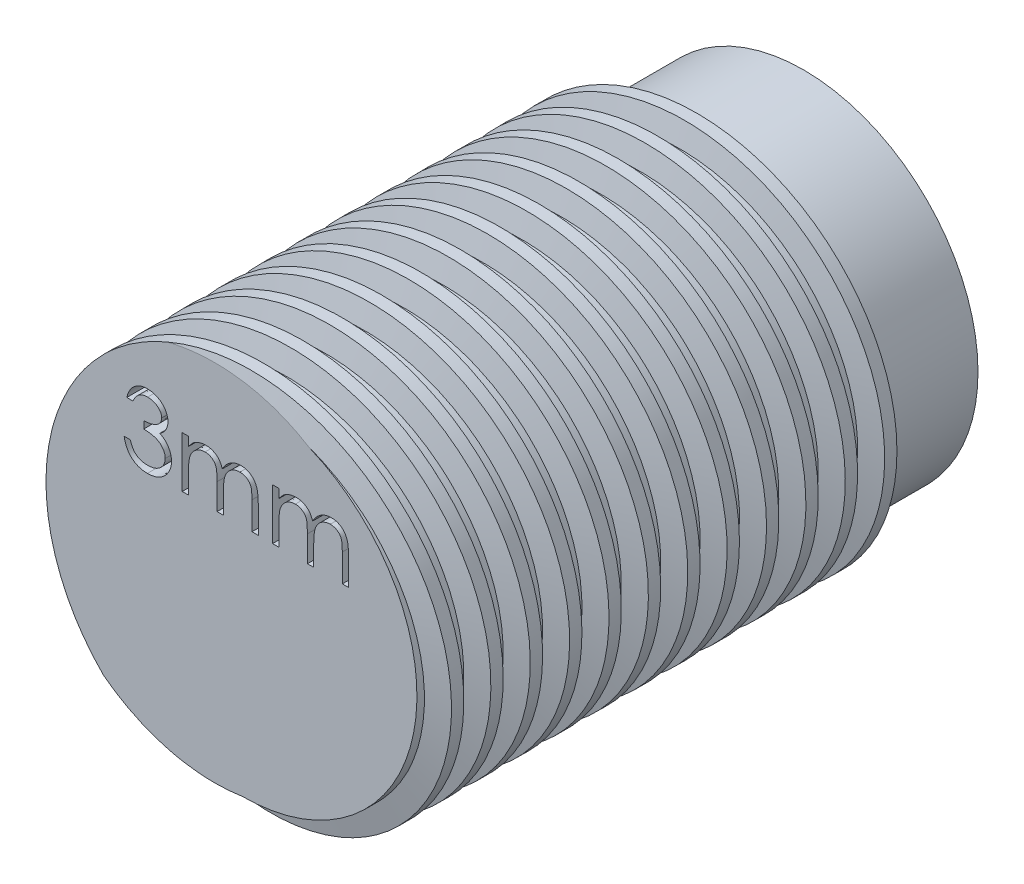
from build123d import *

# Parameters (mm, degrees)
SKETCH1_R           = 4.5
BOSS_EXTRUDE1_DEPTH = 16
SWEEP2_PITCH        = 1.016
SKETCH9_R           = 6.35
CUT_EXTRUDE2_DEPTH  = 1.524
CUT_EXTRUDE14_DEPTH = 7.5
CUT_EXTRUDE16_DEPTH = 1.5
SKETCH25_R          = 1.5
CUT_EXTRUDE17_DEPTH = 1.5


with BuildPart() as part:
    # Sketch1 → Boss-Extrude1 (new body)
    with BuildSketch(Plane.XY):
        Circle(SKETCH1_R)
    extrude(amount=BOSS_EXTRUDE1_DEPTH)

    # Sweep2: arcs per turn and ends read off the stored shape
    # Sweep2: the profile of Sketch7 profile screwed along a right-hand helix through 13.779528 turns, 8 arcs to a turn; built about Z, then put on its axis
    sweep2_z = Axis((0, 0, 0), (0, 0, 1))
    sweep2_corners = [(4.4997, 0, -0.126933333), (4.4997, 0, -0.698566667), (5.0715, 0, -0.5715), (5.0715, 0, -0.254)]
    with BuildLine(mode=Mode.PRIVATE) as sweep2_profile:
        Line(sweep2_corners[0], sweep2_corners[1])
        Line(sweep2_corners[1], sweep2_corners[2])
        Line(sweep2_corners[2], sweep2_corners[3])
        Line(sweep2_corners[3], sweep2_corners[0])
    sweep2_cap = Face(sweep2_profile.wire())
    sweep2_turn_angles = [0, 22.5, 45, 67.5, 90, 112.5, 135, 157.5, 180, 202.5, 225, 247.5, 270, 292.5, 315, 337.5, 360]
    sweep2_turn_weights = [1, 0.9238795325112867, 1, 0.9238795325112867, 1, 0.9238795325112867, 1, 0.9238795325112867, 1, 0.9238795325112867, 1, 0.9238795325112867, 1, 0.9238795325112867, 1, 0.9238795325112867, 1]
    sweep2_turn_rails = [Edge.make_bspline([Vector(p[0], p[1], 0).rotate(sweep2_z, sweep2_turn_angles[k]) / sweep2_turn_weights[k] + Vector(0, 0, p[2] + SWEEP2_PITCH * sweep2_turn_angles[k] / 360) for k in range(17)], [0, 0, 0, 1, 1, 2, 2, 3, 3, 4, 4, 5, 5, 6, 6, 7, 7, 8, 8, 8], 2, sweep2_turn_weights) for p in sweep2_corners]
    sweep2_turn_sides = [Face.make_surface_from_curves(sweep2_turn_rails[p[0]], sweep2_turn_rails[p[1]]) for p in [(0, 1), (1, 2), (2, 3), (3, 0)]]
    sweep2_last_angles = [4680, 4702.5, 4725, 4747.5, 4770, 4792.5, 4815, 4837.5, 4860, 4882.5, 4905, 4927.5, 4950, 4955.31496063, 4960.62992126]
    sweep2_last_weights = [1, 0.9238795325112867, 1, 0.9238795325112867, 1, 0.9238795325112867, 1, 0.9238795325112867, 1, 0.9238795325112867, 1, 0.9238795325112867, 1, 0.9957005451488445, 1]
    sweep2_last_rails = [Edge.make_bspline([Vector(p[0], p[1], 0).rotate(sweep2_z, sweep2_last_angles[k]) / sweep2_last_weights[k] + Vector(0, 0, p[2] + SWEEP2_PITCH * sweep2_last_angles[k] / 360) for k in range(15)], [0, 0, 0, 1, 1, 2, 2, 3, 3, 4, 4, 5, 5, 6, 6, 7, 7, 7], 2, sweep2_last_weights) for p in sweep2_corners]
    sweep2_last_sides = [Face.make_surface_from_curves(sweep2_last_rails[p[0]], sweep2_last_rails[p[1]]) for p in [(0, 1), (1, 2), (2, 3), (3, 0)]]
    sweep2 = Plane(origin=(0, 0, 16), x_dir=(-0.7071067811865512, 0.7071067811865438, 0), z_dir=(0, 0, -1)) * Solid(Shell([*[p.moved(Location((0, 0, SWEEP2_PITCH * i))) for i in range(13) for p in sweep2_turn_sides], *sweep2_last_sides, sweep2_cap, sweep2_cap.rotate(sweep2_z, 4960.62992126).moved(Location((0, 0, SWEEP2_PITCH * 4960.62992126 / 360)))]))
    add(sweep2)

    # Sketch9 → Cut-Extrude2 (cut, symmetric)
    with BuildSketch(Plane.XY.offset(16)):
        Circle(SKETCH9_R)
    extrude(amount=CUT_EXTRUDE2_DEPTH, both=True, mode=Mode.SUBTRACT)

    # Sketch21 → Cut-Extrude14 (cut)
    with BuildSketch(Plane(origin=(0, 0, 0), x_dir=(-1, 0, 0), z_dir=(0, 0, -1))):
        with BuildLine():
            Line((-1.16, 0.950999474), (-1.16, -0.950999474))
            ThreePointArc((-1.16, -0.950999474), (1.5, 0), (-1.16, 0.950999474))
        make_face()
    extrude(amount=-CUT_EXTRUDE14_DEPTH, mode=Mode.SUBTRACT)

    # Sketch24 → Cut-Extrude16 (cut)
    with BuildSketch(Plane.XY.offset(14.476)):
        with BuildLine():
            Line((-2.825209766, 2.923348698), (-2.986748228, 2.923348698))
            add(Edge.make_bspline(
                [(-2.986748228, 2.923348698), (-2.982371888, 2.941468261), (-2.9738165, 2.976890525), (-2.955972034, 3.027499973), (-2.936532417, 3.07539207), (-2.913189449, 3.119670051), (-2.887727804, 3.161223772), (-2.858556118, 3.19911075), (-2.827020261, 3.234294561), (-2.792138859, 3.265518512), (-2.755558404, 3.293792773), (-2.716763457, 3.317899945), (-2.67653454, 3.338638081), (-2.634592929, 3.355722772), (-2.590813755, 3.368593041), (-2.545592806, 3.377930827), (-2.498811577, 3.383994828), (-2.467055673, 3.384586649), (-2.45093092, 3.384887159)],
                knots=[0, 0, 0, 0, 1.162005537, 2.271625781, 3.343758855, 4.383309926, 5.390229558, 6.379919256, 7.361854164, 8.333198761, 9.295911338, 10.242430842, 11.177959212, 12.116337295, 13.062827104, 14.020064771, 14.994644689, 16, 16, 16, 16], degree=3))
            add(Edge.make_bspline(
                [(-2.45093092, 3.384887159), (-2.427436939, 3.384177841), (-2.380961447, 3.382774676), (-2.312683309, 3.369961538), (-2.246840945, 3.349685755), (-2.184155046, 3.321670695), (-2.125928423, 3.28711722), (-2.074121242, 3.245992498), (-2.029435722, 3.19909), (-1.991947185, 3.147284682), (-1.962594328, 3.091918991), (-1.940949907, 3.034936053), (-1.927773043, 2.976471039), (-1.926065328, 2.936995867), (-1.925209766, 2.91721889)],
                knots=[0, 0, 0, 0, 1.083050992, 2.142477498, 3.193116406, 4.255571735, 5.30263384, 6.308962982, 7.297363603, 8.282367274, 9.249857812, 10.179914175, 11.08814088, 12, 12, 12, 12], degree=3))
            add(Edge.make_bspline(
                [(-1.925209766, 2.91721889), (-1.925808185, 2.898186824), (-1.926979196, 2.860944025), (-1.936922245, 2.806572969), (-1.95365518, 2.755328717), (-1.976833915, 2.706995548), (-2.006838141, 2.661879916), (-2.043184099, 2.619880315), (-2.086128325, 2.580810463), (-2.118671779, 2.558429019), (-2.135426113, 2.54690639)],
                knots=[0, 0, 0, 0, 1.024540389, 2.004866551, 2.965041327, 3.920577974, 4.882998113, 5.874504559, 6.905732034, 8, 8, 8, 8], degree=3))
            add(Edge.make_bspline(
                [(-2.135426113, 2.54690639), (-2.116278353, 2.537660473), (-2.078341103, 2.519341638), (-2.026629403, 2.48341582), (-1.979686495, 2.441935412), (-1.95350744, 2.409564905), (-1.940353997, 2.393300621)],
                knots=[0, 0, 0, 0, 1.015518401, 2.012035669, 3.001164323, 4, 4, 4, 4], degree=3))
            add(Edge.make_bspline(
                [(-1.940353997, 2.393300621), (-1.931692735, 2.381442348), (-1.914512046, 2.357919991), (-1.8933052, 2.320101258), (-1.874066227, 2.281863349), (-1.859074686, 2.242181369), (-1.847465268, 2.201515248), (-1.839166737, 2.159795158), (-1.834011465, 2.116987033), (-1.833273181, 2.088026328), (-1.832902074, 2.07346889)],
                knots=[0, 0, 0, 0, 1.025084078, 2.033381695, 3.024893161, 4.013698104, 4.991890475, 5.976764909, 6.982997093, 8, 8, 8, 8], degree=3))
            add(Edge.make_bspline(
                [(-1.832902074, 2.07346889), (-1.833824967, 2.048263891), (-1.835666409, 1.997972507), (-1.852125647, 1.923671221), (-1.877641028, 1.851040963), (-1.913876024, 1.781573903), (-1.958036457, 1.716578278), (-2.010574509, 1.658424748), (-2.070893234, 1.608436894), (-2.13816471, 1.566671634), (-2.211047805, 1.533285274), (-2.289000966, 1.510112875), (-2.370900994, 1.495020647), (-2.427064747, 1.493402257), (-2.45561842, 1.492579467)],
                knots=[0, 0, 0, 0, 0.955779014, 1.907060117, 2.875433937, 3.871313158, 4.872415639, 5.851225146, 6.836215519, 7.83643374, 8.849228613, 9.86973379, 10.916971861, 12, 12, 12, 12], degree=3))
            add(Edge.make_bspline(
                [(-2.45561842, 1.492579467), (-2.474862632, 1.493025977), (-2.512728823, 1.493904559), (-2.568396908, 1.499910696), (-2.621533782, 1.510880413), (-2.672211289, 1.525642113), (-2.720474451, 1.544357866), (-2.766175991, 1.567664625), (-2.809597079, 1.595081969), (-2.850327968, 1.626933529), (-2.888363803, 1.662563932), (-2.922693775, 1.702605709), (-2.95389024, 1.746318659), (-2.981117883, 1.794210517), (-3.005616887, 1.845662363), (-3.025767093, 1.90133302), (-3.043502529, 1.960724802), (-3.05174831, 2.002113354), (-3.055978997, 2.023348698)],
                knots=[0, 0, 0, 0, 1.048658725, 2.063410685, 3.046034179, 4.001477787, 4.936774919, 5.862367409, 6.792675028, 7.730719943, 8.675894397, 9.627829632, 10.600096036, 11.597688215, 12.626045268, 13.701542398, 14.82072376, 16, 16, 16, 16], degree=3))
            Line((-3.055978997, 2.023348698), (-2.894440536, 2.023348698))
            add(Edge.make_bspline(
                [(-2.894440536, 2.023348698), (-2.890231986, 2.009489205), (-2.882045991, 1.982531288), (-2.86811178, 1.943733417), (-2.852236669, 1.908166418), (-2.835206324, 1.875569384), (-2.817320266, 1.845621291), (-2.797306876, 1.819114044), (-2.776648459, 1.794883369), (-2.76107622, 1.781231854), (-2.753454959, 1.774550621)],
                knots=[0, 0, 0, 0, 1.198163088, 2.33053128, 3.407730985, 4.417276592, 5.372219308, 6.28897303, 7.162600585, 8, 8, 8, 8], degree=3))
            add(Edge.make_bspline(
                [(-2.753454959, 1.774550621), (-2.743376719, 1.76678062), (-2.72325135, 1.751264604), (-2.69045626, 1.731463767), (-2.655965747, 1.714306668), (-2.619032486, 1.701200767), (-2.580453461, 1.690103684), (-2.539605102, 1.682841703), (-2.49684779, 1.677859215), (-2.46765294, 1.677419536), (-2.452733805, 1.677194852)],
                knots=[0, 0, 0, 0, 0.946170439, 1.889420265, 2.845303464, 3.807233317, 4.801018734, 5.828864929, 6.890507805, 8, 8, 8, 8], degree=3))
            add(Edge.make_bspline(
                [(-2.452733805, 1.677194852), (-2.435889146, 1.677511603), (-2.402950871, 1.678130983), (-2.354888372, 1.68382706), (-2.309164542, 1.692122702), (-2.266287037, 1.704935093), (-2.225694204, 1.720765245), (-2.18795507, 1.740641568), (-2.152574216, 1.76396171), (-2.120004807, 1.790467563), (-2.090718546, 1.819484332), (-2.064932511, 1.849833912), (-2.043011256, 1.881388338), (-2.025328273, 1.914322229), (-2.011365133, 1.948499204), (-2.001859487, 1.984015173), (-1.995250137, 2.020579482), (-1.994711879, 2.04543438), (-1.994440536, 2.057964082)],
                knots=[0, 0, 0, 0, 1.217147791, 2.380027433, 3.494444702, 4.572153297, 5.609568379, 6.639424714, 7.649109417, 8.668170816, 9.669597737, 10.625200337, 11.543417969, 12.441394052, 13.322311151, 14.205496177, 15.095365482, 16, 16, 16, 16], degree=3))
            add(Edge.make_bspline(
                [(-1.994440536, 2.057964082), (-1.995227548, 2.074735628), (-1.996797656, 2.108195267), (-2.008784926, 2.157421448), (-2.028502056, 2.204850631), (-2.056105062, 2.249673609), (-2.089706293, 2.291215501), (-2.128979674, 2.328280835), (-2.174251334, 2.358865453), (-2.215918696, 2.379996762), (-2.25282649, 2.394415829), (-2.284411545, 2.404020097), (-2.319772084, 2.412152834), (-2.358480492, 2.419719145), (-2.400828432, 2.426158696), (-2.4467698, 2.431528772), (-2.496313906, 2.43582565), (-2.53061222, 2.437744499), (-2.548286689, 2.438733313)],
                knots=[0, 0, 0, 0, 1.07054697, 2.135767047, 3.216561865, 4.33974944, 5.486079747, 6.621378074, 7.775625952, 8.963672916, 9.598146892, 10.304877434, 11.070270905, 11.915000392, 12.823868403, 13.805723172, 14.86925407, 16, 16, 16, 16], degree=3))
            Line((-2.548286689, 2.438733313), (-2.548286689, 2.623348698))
            add(Edge.make_bspline(
                [(-2.548286689, 2.623348698), (-2.526017519, 2.623726597), (-2.482397683, 2.624466808), (-2.418680612, 2.633419499), (-2.35775148, 2.645803822), (-2.300960584, 2.66477335), (-2.249198389, 2.686805502), (-2.204291165, 2.712443782), (-2.166868061, 2.740942795), (-2.137110938, 2.772742423), (-2.114724478, 2.806847305), (-2.09835641, 2.842393014), (-2.088687671, 2.879691103), (-2.087396985, 2.905145503), (-2.086748228, 2.917940044)],
                knots=[0, 0, 0, 0, 1.321986639, 2.589447074, 3.816329219, 5.01088745, 6.139805852, 7.153945165, 8.075214402, 8.924034688, 9.728124013, 10.488707548, 11.240355623, 12, 12, 12, 12], degree=3))
            add(Edge.make_bspline(
                [(-2.086748228, 2.917940044), (-2.086961354, 2.927340027), (-2.087385357, 2.946040848), (-2.092732528, 2.973362312), (-2.100767749, 2.999848512), (-2.111814467, 3.025386815), (-2.126600284, 3.049800099), (-2.144294791, 3.073296501), (-2.1653641, 3.095741873), (-2.189507473, 3.11666318), (-2.215433544, 3.136601645), (-2.243847714, 3.153528658), (-2.273893249, 3.168003262), (-2.305603415, 3.179939577), (-2.339081116, 3.18891864), (-2.37416906, 3.195365644), (-2.410934154, 3.199396438), (-2.436016759, 3.199976766), (-2.448767459, 3.200271775)],
                knots=[0, 0, 0, 0, 0.884392785, 1.759457502, 2.611959086, 3.489218968, 4.37281399, 5.2945488, 6.255912374, 7.266815255, 8.301784654, 9.332968512, 10.37626691, 11.440494194, 12.520033166, 13.637162961, 14.798855837, 16, 16, 16, 16], degree=3))
            add(Edge.make_bspline(
                [(-2.448767459, 3.200271775), (-2.469262602, 3.199556217), (-2.509294384, 3.198158567), (-2.567004913, 3.185917017), (-2.620654856, 3.166385431), (-2.661663313, 3.143071307), (-2.69194578, 3.120056798), (-2.713585348, 3.099957285), (-2.734835897, 3.077620404), (-2.754299387, 3.051670383), (-2.773983147, 3.023864605), (-2.791903207, 2.992789569), (-2.809316763, 2.95925588), (-2.819809503, 2.935549554), (-2.825209766, 2.923348698)],
                knots=[0, 0, 0, 0, 1.472543308, 2.876219568, 4.221790263, 5.565193594, 6.249813518, 6.953379497, 7.687249741, 8.463570142, 9.283606569, 10.136032583, 11.040678096, 12, 12, 12, 12], degree=3))
        make_face()
        with BuildLine():
            Line((-1.555978997, 2.854117928), (-1.394440536, 2.854117928))
            Line((-1.394440536, 2.854117928), (-1.394440536, 2.625512159))
            add(Edge.make_bspline(
                [(-1.394440536, 2.625512159), (-1.379894504, 2.645511497), (-1.352022914, 2.683832146), (-1.306320578, 2.734330007), (-1.260664292, 2.777184486), (-1.227784267, 2.79968082), (-1.211988613, 2.810488121)],
                knots=[0, 0, 0, 0, 1.134379233, 2.173579362, 3.122582517, 4, 4, 4, 4], degree=3))
            add(Edge.make_bspline(
                [(-1.211988613, 2.810488121), (-1.190458215, 2.820776594), (-1.147773581, 2.84117379), (-1.080186551, 2.861865334), (-1.011028149, 2.874581101), (-0.964326782, 2.876320093), (-0.940834766, 2.877194852)],
                knots=[0, 0, 0, 0, 1.014936303, 2.012140481, 3.000054389, 4, 4, 4, 4], degree=3))
            add(Edge.make_bspline(
                [(-0.940834766, 2.877194852), (-0.92494694, 2.876657273), (-0.893505785, 2.875593435), (-0.846919681, 2.868671131), (-0.801735252, 2.856705671), (-0.758219466, 2.840039047), (-0.717220259, 2.819855037), (-0.679631529, 2.79617233), (-0.645881936, 2.769585263), (-0.615988538, 2.73889324), (-0.589107325, 2.703234418), (-0.564381061, 2.66164709), (-0.541533809, 2.613197436), (-0.528871422, 2.5780375), (-0.522204959, 2.559526582)],
                knots=[0, 0, 0, 0, 1.009824226, 1.998387844, 2.986035974, 3.974953746, 4.955485308, 5.885931332, 6.793869504, 7.679848016, 8.601185859, 9.625726857, 10.749998409, 12, 12, 12, 12], degree=3))
            add(Edge.make_bspline(
                [(-0.522204959, 2.559526582), (-0.515153458, 2.572241998), (-0.501277095, 2.59726415), (-0.477977053, 2.632676971), (-0.453565043, 2.665800464), (-0.427833018, 2.696660911), (-0.400871802, 2.725105915), (-0.372554511, 2.751229521), (-0.343042337, 2.775143917), (-0.302006328, 2.803081542), (-0.248616987, 2.832756435), (-0.1813031, 2.858485349), (-0.111283012, 2.874385072), (-0.06375391, 2.87625207), (-0.039753036, 2.877194852)],
                knots=[0, 0, 0, 0, 0.86119277, 1.694706429, 2.50939023, 3.298075842, 4.073795165, 4.829715201, 5.57930267, 6.321991688, 7.768977793, 9.186738141, 10.579381044, 12, 12, 12, 12], degree=3))
            add(Edge.make_bspline(
                [(-0.039753036, 2.877194852), (-0.017699712, 2.876363138), (0.025460784, 2.874735394), (0.088294806, 2.861953607), (0.146893449, 2.840005103), (0.201138802, 2.810056376), (0.250078135, 2.772421367), (0.292617951, 2.727643108), (0.328499852, 2.67603833), (0.351940296, 2.627493879), (0.367839574, 2.584635708), (0.377642495, 2.548118187), (0.38630291, 2.507925959), (0.393493264, 2.464010968), (0.39874852, 2.416218083), (0.40264203, 2.364625519), (0.405277268, 2.309193176), (0.405463477, 2.270948061), (0.405559464, 2.251233313)],
                knots=[0, 0, 0, 0, 1.209669288, 2.367440248, 3.500751976, 4.631527125, 5.755587489, 6.87532382, 8.007944318, 9.190864318, 9.82315674, 10.514484317, 11.263564316, 12.079023757, 12.955305781, 13.901327259, 14.918167583, 16, 16, 16, 16], degree=3))
            Line((0.405559464, 2.251233313), (0.405559464, 1.538733313))
            Line((0.405559464, 1.538733313), (0.244021003, 1.538733313))
            Line((0.244021003, 1.538733313), (0.244021003, 2.251954467))
            add(Edge.make_bspline(
                [(0.244021003, 2.251954467), (0.243980949, 2.268782191), (0.243903971, 2.301122516), (0.242518675, 2.347538063), (0.239908513, 2.389847504), (0.236856413, 2.427993149), (0.23261674, 2.462063954), (0.227141689, 2.491991484), (0.22134174, 2.518011158), (0.211706087, 2.546855412), (0.196304314, 2.578674377), (0.172843896, 2.612989359), (0.143287841, 2.642859485), (0.109159761, 2.668788905), (0.070306275, 2.689871349), (0.027484417, 2.704927582), (-0.019039952, 2.71424792), (-0.051245958, 2.715176728), (-0.067878036, 2.71565639)],
                knots=[0, 0, 0, 0, 1.253487763, 2.409012846, 3.458416907, 4.410876679, 5.259312806, 6.014470957, 6.676830364, 7.243083969, 8.276244668, 9.299465089, 10.325150304, 11.392391894, 12.482080715, 13.603491619, 14.762376348, 16, 16, 16, 16], degree=3))
            add(Edge.make_bspline(
                [(-0.067878036, 2.71565639), (-0.088279726, 2.71492808), (-0.128601224, 2.713488664), (-0.187458902, 2.698793529), (-0.244015425, 2.676637972), (-0.296583208, 2.644529851), (-0.344940357, 2.606056978), (-0.386545854, 2.560311472), (-0.420916693, 2.508558938), (-0.444190166, 2.46065492), (-0.458893235, 2.41762492), (-0.468601363, 2.380031986), (-0.476152822, 2.337304322), (-0.483234808, 2.289729041), (-0.487857068, 2.236978663), (-0.492057946, 2.179297199), (-0.494022961, 2.116511163), (-0.494297825, 2.072988866), (-0.494440536, 2.050391967)],
                knots=[0, 0, 0, 0, 1.090531906, 2.155305635, 3.229839962, 4.33261226, 5.44038871, 6.529323825, 7.629011124, 8.757537029, 9.370236727, 10.061839251, 10.834451254, 11.692844982, 12.636905849, 13.66920014, 14.789842145, 16, 16, 16, 16], degree=3))
            Line((-0.494440536, 2.050391967), (-0.494440536, 1.538733313))
            Line((-0.494440536, 1.538733313), (-0.655978997, 1.538733313))
            Line((-0.655978997, 1.538733313), (-0.655978997, 2.207603505))
            add(Edge.make_bspline(
                [(-0.655978997, 2.207603505), (-0.656019847, 2.226474355), (-0.656098439, 2.262779973), (-0.657474831, 2.314843006), (-0.660090808, 2.36219899), (-0.66311509, 2.404792886), (-0.667466039, 2.442547283), (-0.672408202, 2.475664588), (-0.67824463, 2.504061774), (-0.687908, 2.535208657), (-0.70267544, 2.569522275), (-0.726429404, 2.606109086), (-0.756056159, 2.638132679), (-0.790806895, 2.665471464), (-0.829895532, 2.68806994), (-0.873086995, 2.704352098), (-0.919992379, 2.713827447), (-0.952329485, 2.715035245), (-0.968959766, 2.71565639)],
                knots=[0, 0, 0, 0, 1.320475261, 2.540461679, 3.643808994, 4.639130445, 5.527981419, 6.302341397, 6.981980563, 7.553956391, 8.582137848, 9.585246428, 10.591171744, 11.620968678, 12.668337649, 13.738356861, 14.836885341, 16, 16, 16, 16], degree=3))
            add(Edge.make_bspline(
                [(-0.968959766, 2.71565639), (-0.988510961, 2.714869296), (-1.027475797, 2.713300646), (-1.08471681, 2.699181306), (-1.139995162, 2.677064924), (-1.192429007, 2.646382732), (-1.240604283, 2.608377491), (-1.282779963, 2.563678402), (-1.318236119, 2.512841756), (-1.341755338, 2.465442862), (-1.356925982, 2.423490892), (-1.367003583, 2.38782469), (-1.375663962, 2.348224563), (-1.382099745, 2.304568334), (-1.38831253, 2.257140343), (-1.391310974, 2.20570432), (-1.394227778, 2.150304389), (-1.394367877, 2.112055651), (-1.394440536, 2.09221889)],
                knots=[0, 0, 0, 0, 1.098833095, 2.189935336, 3.297829714, 4.440610912, 5.596351641, 6.740013378, 7.886572111, 9.072425424, 9.705826452, 10.395263256, 11.156850408, 11.985370555, 12.878090359, 13.847760091, 14.883794034, 16, 16, 16, 16], degree=3))
            Line((-1.394440536, 2.09221889), (-1.394440536, 1.538733313))
            Line((-1.394440536, 1.538733313), (-1.555978997, 1.538733313))
            Line((-1.555978997, 1.538733313), (-1.555978997, 2.854117928))
        make_face()
        with BuildLine():
            Line((0.774790234, 2.854117928), (0.936328695, 2.854117928))
            Line((0.936328695, 2.854117928), (0.936328695, 2.625512159))
            add(Edge.make_bspline(
                [(0.936328695, 2.625512159), (0.950874727, 2.645511497), (0.978746317, 2.683832146), (1.024448653, 2.734330007), (1.070104939, 2.777184486), (1.102984964, 2.79968082), (1.118780618, 2.810488121)],
                knots=[0, 0, 0, 0, 1.134379233, 2.173579362, 3.122582517, 4, 4, 4, 4], degree=3))
            add(Edge.make_bspline(
                [(1.118780618, 2.810488121), (1.140311016, 2.820776594), (1.18299565, 2.84117379), (1.25058268, 2.861865334), (1.319741082, 2.874581101), (1.366442449, 2.876320093), (1.389934464, 2.877194852)],
                knots=[0, 0, 0, 0, 1.014936303, 2.012140481, 3.000054389, 4, 4, 4, 4], degree=3))
            add(Edge.make_bspline(
                [(1.389934464, 2.877194852), (1.405822291, 2.876657273), (1.437263446, 2.875593435), (1.48384955, 2.868671131), (1.529033979, 2.856705671), (1.572549765, 2.840039047), (1.613548972, 2.819855037), (1.651137702, 2.79617233), (1.684887295, 2.769585263), (1.714780692, 2.73889324), (1.741661905, 2.703234418), (1.766388169, 2.66164709), (1.789235422, 2.613197436), (1.801897809, 2.5780375), (1.808564272, 2.559526582)],
                knots=[0, 0, 0, 0, 1.009824226, 1.998387844, 2.986035974, 3.974953746, 4.955485308, 5.885931332, 6.793869504, 7.679848016, 8.601185859, 9.625726857, 10.749998409, 12, 12, 12, 12], degree=3))
            add(Edge.make_bspline(
                [(1.808564272, 2.559526582), (1.815615773, 2.572241998), (1.829492136, 2.59726415), (1.852792178, 2.632676971), (1.877204187, 2.665800464), (1.902936212, 2.696660911), (1.929897429, 2.725105915), (1.95821472, 2.751229521), (1.987726893, 2.775143917), (2.028762902, 2.803081542), (2.082152243, 2.832756435), (2.149466131, 2.858485349), (2.219486219, 2.874385072), (2.267015321, 2.87625207), (2.291016195, 2.877194852)],
                knots=[0, 0, 0, 0, 0.86119277, 1.694706429, 2.50939023, 3.298075842, 4.073795165, 4.829715201, 5.57930267, 6.321991688, 7.768977793, 9.186738141, 10.579381044, 12, 12, 12, 12], degree=3))
            add(Edge.make_bspline(
                [(2.291016195, 2.877194852), (2.313069519, 2.876363138), (2.356230015, 2.874735394), (2.419064037, 2.861953607), (2.47766268, 2.840005103), (2.531908033, 2.810056376), (2.580847366, 2.772421367), (2.623387182, 2.727643108), (2.659269083, 2.67603833), (2.682709526, 2.627493879), (2.698608805, 2.584635708), (2.708411726, 2.548118187), (2.71707214, 2.507925959), (2.724262495, 2.464010968), (2.72951775, 2.416218083), (2.733411261, 2.364625519), (2.736046499, 2.309193176), (2.736232708, 2.270948061), (2.736328695, 2.251233313)],
                knots=[0, 0, 0, 0, 1.209669288, 2.367440248, 3.500751976, 4.631527125, 5.755587489, 6.87532382, 8.007944318, 9.190864318, 9.82315674, 10.514484317, 11.263564316, 12.079023757, 12.955305781, 13.901327259, 14.918167583, 16, 16, 16, 16], degree=3))
            Line((2.736328695, 2.251233313), (2.736328695, 1.538733313))
            Line((2.736328695, 1.538733313), (2.574790234, 1.538733313))
            Line((2.574790234, 1.538733313), (2.574790234, 2.251954467))
            add(Edge.make_bspline(
                [(2.574790234, 2.251954467), (2.57475018, 2.268782191), (2.574673202, 2.301122516), (2.573287905, 2.347538063), (2.570677744, 2.389847504), (2.567625644, 2.427993149), (2.563385971, 2.462063954), (2.55791092, 2.491991484), (2.55211097, 2.518011158), (2.542475318, 2.546855412), (2.527073545, 2.578674377), (2.503613127, 2.612989359), (2.474057072, 2.642859485), (2.439928991, 2.668788905), (2.401075506, 2.689871349), (2.358253648, 2.704927582), (2.311729279, 2.71424792), (2.279523273, 2.715176728), (2.262891195, 2.71565639)],
                knots=[0, 0, 0, 0, 1.253487763, 2.409012846, 3.458416907, 4.410876679, 5.259312806, 6.014470957, 6.676830364, 7.243083969, 8.276244668, 9.299465089, 10.325150304, 11.392391894, 12.482080715, 13.603491619, 14.762376348, 16, 16, 16, 16], degree=3))
            add(Edge.make_bspline(
                [(2.262891195, 2.71565639), (2.242489504, 2.71492808), (2.202168007, 2.713488664), (2.143310329, 2.698793529), (2.086753806, 2.676637972), (2.034186023, 2.644529851), (1.985828874, 2.606056978), (1.944223376, 2.560311472), (1.909852538, 2.508558938), (1.886579065, 2.46065492), (1.871875996, 2.41762492), (1.862167867, 2.380031986), (1.854616409, 2.337304322), (1.847534423, 2.289729041), (1.842912162, 2.236978663), (1.838711285, 2.179297199), (1.83674627, 2.116511163), (1.836471406, 2.072988866), (1.836328695, 2.050391967)],
                knots=[0, 0, 0, 0, 1.090531906, 2.155305635, 3.229839962, 4.33261226, 5.44038871, 6.529323825, 7.629011124, 8.757537029, 9.370236727, 10.061839251, 10.834451254, 11.692844982, 12.636905849, 13.66920014, 14.789842145, 16, 16, 16, 16], degree=3))
            Line((1.836328695, 2.050391967), (1.836328695, 1.538733313))
            Line((1.836328695, 1.538733313), (1.674790234, 1.538733313))
            Line((1.674790234, 1.538733313), (1.674790234, 2.207603505))
            add(Edge.make_bspline(
                [(1.674790234, 2.207603505), (1.674749383, 2.226474355), (1.674670792, 2.262779973), (1.6732944, 2.314843006), (1.670678423, 2.36219899), (1.667654141, 2.404792886), (1.663303192, 2.442547283), (1.658361029, 2.475664588), (1.6525246, 2.504061774), (1.642861231, 2.535208657), (1.62809379, 2.569522275), (1.604339827, 2.606109086), (1.574713071, 2.638132679), (1.539962335, 2.665471464), (1.500873699, 2.68806994), (1.457682235, 2.704352098), (1.410776852, 2.713827447), (1.378439746, 2.715035245), (1.361809464, 2.71565639)],
                knots=[0, 0, 0, 0, 1.320475261, 2.540461679, 3.643808994, 4.639130445, 5.527981419, 6.302341397, 6.981980563, 7.553956391, 8.582137848, 9.585246428, 10.591171744, 11.620968678, 12.668337649, 13.738356861, 14.836885341, 16, 16, 16, 16], degree=3))
            add(Edge.make_bspline(
                [(1.361809464, 2.71565639), (1.34225827, 2.714869296), (1.303293434, 2.713300646), (1.246052421, 2.699181306), (1.190774069, 2.677064924), (1.138340224, 2.646382732), (1.090164948, 2.608377491), (1.047989267, 2.563678402), (1.012533111, 2.512841756), (0.989013892, 2.465442862), (0.973843249, 2.423490892), (0.963765648, 2.38782469), (0.955105269, 2.348224563), (0.948669486, 2.304568334), (0.942456701, 2.257140343), (0.939458256, 2.20570432), (0.936541453, 2.150304389), (0.936401354, 2.112055651), (0.936328695, 2.09221889)],
                knots=[0, 0, 0, 0, 1.098833095, 2.189935336, 3.297829714, 4.440610912, 5.596351641, 6.740013378, 7.886572111, 9.072425424, 9.705826452, 10.395263256, 11.156850408, 11.985370555, 12.878090359, 13.847760091, 14.883794034, 16, 16, 16, 16], degree=3))
            Line((0.936328695, 2.09221889), (0.936328695, 1.538733313))
            Line((0.936328695, 1.538733313), (0.774790234, 1.538733313))
            Line((0.774790234, 1.538733313), (0.774790234, 2.854117928))
        make_face()
    extrude(amount=-CUT_EXTRUDE16_DEPTH, mode=Mode.SUBTRACT)

    # Sketch25 → Cut-Extrude17 (cut)
    with BuildSketch(Plane(origin=(0, 0, 7.5), x_dir=(-1, 0, 0), z_dir=(0, 0, -1))):
        Circle(SKETCH25_R)
    extrude(amount=-CUT_EXTRUDE17_DEPTH, mode=Mode.SUBTRACT)


solid = part.part
